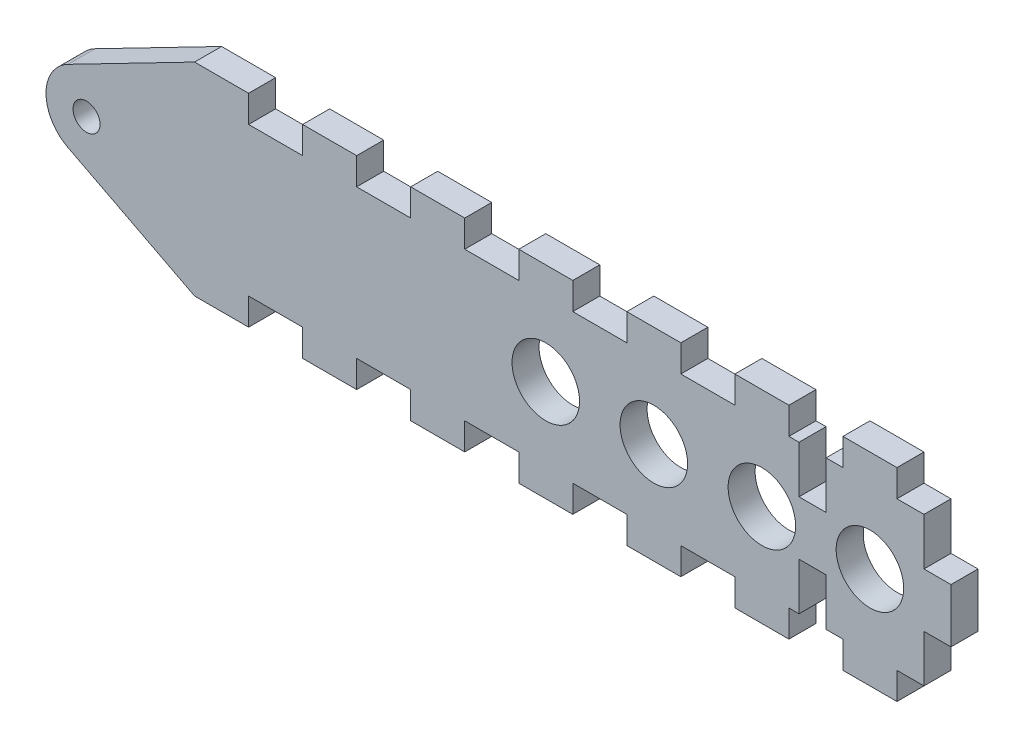
from build123d import *

# Parameters (mm, degrees)
MASS_DEPTH          = 6.35
SKETCH4_R           = 3.175
CUT_EXTRUDE1_DEPTH  = 127.253666407
SKETCH3_W           = 12.7
SKETCH3_H           = 12.7
CUT_EXTRUDE2_DEPTH  = 127.253666407
LPATTERN1_COUNT     = 7
LPATTERN1_PITCH     = 25.4
SKETCH5_R           = 7.9375
CUT_EXTRUDE3_DEPTH  = 127.253666407
LPATTERN2_COUNT     = 4
LPATTERN2_PITCH     = 25.4
CAVITY1_START       = 53.18125
CAVITY1_OUTLINE_W   = 11.1125
CAVITY1_OUTLINE_H   = 6.35
CAVITY1_DEPTH       = 6.35
CAVITY1_START_2     = 82.55
CAVITY1_2_OUTLINE_W = 11.1125
CAVITY1_2_OUTLINE_H = 6.35
CAVITY1_2_DEPTH     = 6.35


# Read off the part's stored shape, not the designer's step: Cavity1
with BuildPart() as part:
    # Sketch1 → Mass (new body)
    with BuildSketch(Plane.XY):
        with BuildLine():
            Line((-88.9, -23.8125), (88.9, -23.8125))
            Line((88.9, -23.8125), (88.9, 23.8125))
            Line((88.9, 23.8125), (-88.9, 23.8125))
            Line((-88.9, 23.8125), (-118.664971781, 8.4659699))
            ThreePointArc((-118.664971781, 8.4659699), (-123.825, 0), (-118.664971781, -8.4659699))
            Line((-118.664971781, -8.4659699), (-88.9, -23.8125))
        make_face()
    extrude(amount=MASS_DEPTH)

    # Sketch4 → Cut-Extrude1 (cut, through all)
    with BuildSketch(Plane(origin=(0, 0, 0), x_dir=(-1, 0, 0), z_dir=(0, 0, -1))):
        with Locations((114.3, 0)):
            Circle(SKETCH4_R)
    extrude(amount=-CUT_EXTRUDE1_DEPTH, mode=Mode.SUBTRACT)

    # Sketch3 → Cut-Extrude2 (cut, through all)
    with BuildSketch(Plane(origin=(0, 0, 0), x_dir=(-1, 0, 0), z_dir=(0, 0, -1))):
        with Locations((-82.55, 23.8125)):
            Rectangle(SKETCH3_W, SKETCH3_H)
        with Locations((-82.55, -23.8125)):
            Rectangle(SKETCH3_W, SKETCH3_H)
    cut_extrude2 = extrude(amount=-CUT_EXTRUDE2_DEPTH, mode=Mode.SUBTRACT)

    # LPattern1: Cut-Extrude2 ×7
    with Locations(*[(-i * LPATTERN1_PITCH, 0, 0) for i in range(1, LPATTERN1_COUNT)]):
        add(cut_extrude2, mode=Mode.SUBTRACT)

    # Sketch5 → Cut-Extrude3 (cut, through all)
    with BuildSketch(Plane.XY.offset(6.35)):
        with Locations((69.85, 0)):
            Circle(SKETCH5_R)
    cut_extrude3 = extrude(amount=-CUT_EXTRUDE3_DEPTH, mode=Mode.SUBTRACT)

    # LPattern2: Cut-Extrude3 ×4
    with Locations(*[(-i * LPATTERN2_PITCH, 0, 0) for i in range(1, LPATTERN2_COUNT)]):
        add(cut_extrude3, mode=Mode.SUBTRACT)

    # Cavity1 outline → Cavity1 (cut)
    with BuildSketch(Plane.YZ.offset(CAVITY1_START)):
        with Locations((-11.90625, 3.175)):
            Rectangle(CAVITY1_OUTLINE_W, CAVITY1_OUTLINE_H)
        with Locations((11.90625, 3.175)):
            Rectangle(CAVITY1_OUTLINE_W, CAVITY1_OUTLINE_H)
    extrude(amount=CAVITY1_DEPTH, mode=Mode.SUBTRACT)

    # Cavity1 2 outline → Cavity1 2 (cut)
    with BuildSketch(Plane.YZ.offset(CAVITY1_START_2)):
        with Locations((-11.90625, 3.175)):
            Rectangle(CAVITY1_2_OUTLINE_W, CAVITY1_2_OUTLINE_H)
        with Locations((11.90625, 3.175)):
            Rectangle(CAVITY1_2_OUTLINE_W, CAVITY1_2_OUTLINE_H)
    extrude(amount=CAVITY1_2_DEPTH, mode=Mode.SUBTRACT)


solid = part.part
